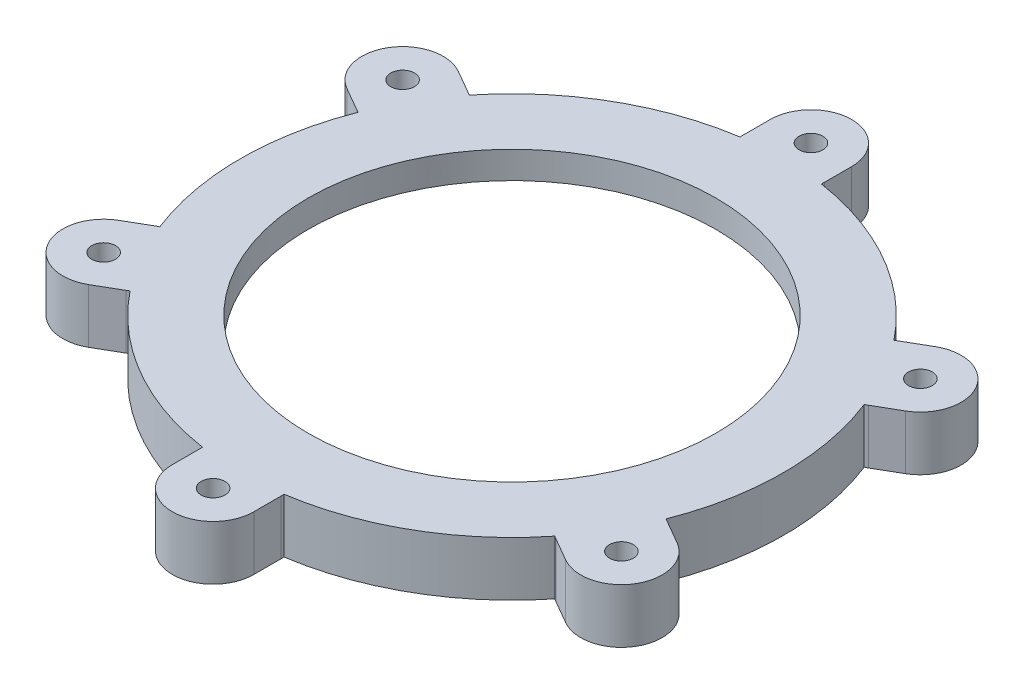
from build123d import *

# Parameters (mm, degrees)
SKETCH1_R           = 30
SKETCH1_R_2         = 1.75
BOSS_EXTRUDE1_DEPTH = 8
SKETCH6_R           = 36
CUT_EXTRUDE2_DEPTH  = 4


with BuildPart() as part:
    # Sketch1 → Boss-Extrude1 (new body)
    with BuildSketch(Plane(origin=(0, 0, 0), x_dir=(1, 0, 0), z_dir=(0, 1, 0))):
        with BuildLine():
            Line((-6, 40), (-6, 44))
            ThreePointArc((-6, 44), (0, 50), (6, 44))
            Line((6, 44), (6, 40))
            ThreePointArc((6, 40), (5.995773812, 39.774841406), (5.983101203, 39.55))
            ThreePointArc((5.983101203, 39.55), (20, 34.641016151), (31.259754118, 24.956517635))
            ThreePointArc((31.259754118, 24.956517635), (31.448136183, 25.07991314), (31.641016151, 25.196152423))
            Line((31.641016151, 25.196152423), (35.105117767, 27.196152423))
            ThreePointArc((35.105117767, 27.196152423), (43.301270189, 25), (41.105117767, 16.803847577))
            Line((41.105117767, 16.803847577), (37.641016151, 14.803847577))
            ThreePointArc((37.641016151, 14.803847577), (37.443909995, 14.694928266), (37.242855321, 14.593482365))
            ThreePointArc((37.242855321, 14.593482365), (40, 0), (37.242855321, -14.593482365))
            ThreePointArc((37.242855321, -14.593482365), (37.443909995, -14.694928266), (37.641016151, -14.803847577))
            Line((37.641016151, -14.803847577), (41.105117767, -16.803847577))
            ThreePointArc((41.105117767, -16.803847577), (43.301270189, -25), (35.105117767, -27.196152423))
            Line((35.105117767, -27.196152423), (31.641016151, -25.196152423))
            ThreePointArc((31.641016151, -25.196152423), (31.448136183, -25.07991314), (31.259754118, -24.956517635))
            ThreePointArc((31.259754118, -24.956517635), (20, -34.641016151), (5.983101203, -39.55))
            ThreePointArc((5.983101203, -39.55), (5.995773812, -39.774841406), (6, -40))
            Line((6, -40), (6, -44))
            ThreePointArc((6, -44), (0, -50), (-6, -44))
            Line((-6, -44), (-6, -40))
            ThreePointArc((-6, -40), (-5.995773812, -39.774841406), (-5.983101203, -39.55))
            ThreePointArc((-5.983101203, -39.55), (-20, -34.641016151), (-31.259754118, -24.956517635))
            ThreePointArc((-31.259754118, -24.956517635), (-31.448136183, -25.07991314), (-31.641016151, -25.196152423))
            Line((-31.641016151, -25.196152423), (-35.105117767, -27.196152423))
            ThreePointArc((-35.105117767, -27.196152423), (-43.301270189, -25), (-41.105117767, -16.803847577))
            Line((-41.105117767, -16.803847577), (-37.641016151, -14.803847577))
            ThreePointArc((-37.641016151, -14.803847577), (-37.443909995, -14.694928266), (-37.242855321, -14.593482365))
            ThreePointArc((-37.242855321, -14.593482365), (-40, 0), (-37.242855321, 14.593482365))
            ThreePointArc((-37.242855321, 14.593482365), (-37.443909995, 14.694928266), (-37.641016151, 14.803847577))
            Line((-37.641016151, 14.803847577), (-41.105117767, 16.803847577))
            ThreePointArc((-41.105117767, 16.803847577), (-43.301270189, 25), (-35.105117767, 27.196152423))
            Line((-35.105117767, 27.196152423), (-31.641016151, 25.196152423))
            ThreePointArc((-31.641016151, 25.196152423), (-31.448136183, 25.07991314), (-31.259754118, 24.956517635))
            ThreePointArc((-31.259754118, 24.956517635), (-20, 34.641016151), (-5.983101203, 39.55))
            ThreePointArc((-5.983101203, 39.55), (-5.995773812, 39.774841406), (-6, 40))
        make_face()
        Circle(SKETCH1_R, mode=Mode.SUBTRACT)
        with Locations((0, 44)):
            Circle(SKETCH1_R_2, mode=Mode.SUBTRACT)
        with Locations((38.105117767, 22)):
            Circle(SKETCH1_R_2, mode=Mode.SUBTRACT)
        with Locations((38.105117767, -22)):
            Circle(SKETCH1_R_2, mode=Mode.SUBTRACT)
        with Locations((0, -44)):
            Circle(SKETCH1_R_2, mode=Mode.SUBTRACT)
        with Locations((-38.105117767, -22)):
            Circle(SKETCH1_R_2, mode=Mode.SUBTRACT)
        with Locations((-38.105117767, 22)):
            Circle(SKETCH1_R_2, mode=Mode.SUBTRACT)
    extrude(amount=BOSS_EXTRUDE1_DEPTH)

    # Sketch6 → Cut-Extrude2 (cut)
    with BuildSketch(Plane.XZ):
        Circle(SKETCH6_R)
    extrude(amount=-CUT_EXTRUDE2_DEPTH, mode=Mode.SUBTRACT)


solid = part.part
